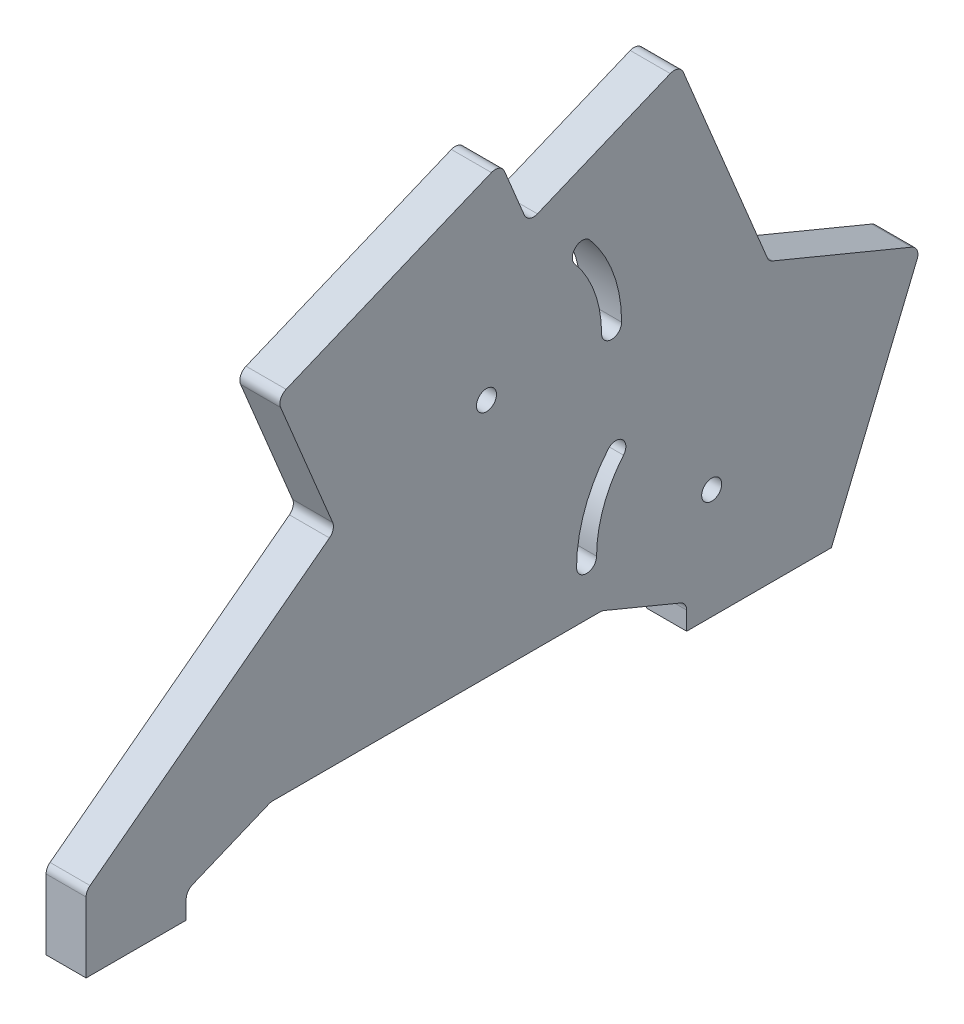
from build123d import *

# Parameters (mm, degrees)
SKETCH1_R                   = 2
BOSS_EXTRUDE1_DEPTH         = 8
FILLET1_R                   = 2
TAP_DRILL_FOR_M3_TAP1_D     = 2.5
TAP_DRILL_FOR_M3_TAP1_DEPTH = 10
TAP_DRILL_FOR_M3_TAP1_TIP   = 0.751075774


with BuildPart() as part:
    # Sketch1 → Boss-Extrude1 (new body)
    with BuildSketch(Plane(origin=(0, 0, 0), x_dir=(0, 0, -1), z_dir=(1, 0, 0))):
        Polygon((0, 0), (0, 15), (49.854455432, 52.772847367), (38.110170638, 81.126058999), (82.834388097, 99.651436437), (88.330517158, 86.382607119), (118.575687602, 98.910566914), (136.428533447, 55.809984346), (166.824723678, 43.219470108), (148.922633001, 0), (120, 0), (120, 5), (103.100505063, 12), (36.899494937, 12), (20, 5), (20, 0), align=None)
        with Locations((80, 60)):
            Circle(SKETCH1_R, mode=Mode.SUBTRACT)
        with Locations((125, 22)):
            Circle(SKETCH1_R, mode=Mode.SUBTRACT)
        with BuildLine():
            ThreePointArc((107, 60), (105.371700761, 69.23454387), (100.683199964, 77.355265462))
            ThreePointArc((100.683199964, 77.355265462), (97.865535859, 77.601779128), (97.619022192, 74.784115023))
            ThreePointArc((97.619022192, 74.784115023), (101.612930278, 67.866463296), (103, 60))
            ThreePointArc((103, 60), (105, 58), (107, 60))
        make_face(mode=Mode.SUBTRACT)
        with BuildLine():
            ThreePointArc((104.316800036, 39.355265462), (99.628299239, 31.23454387), (98, 22))
            ThreePointArc((98, 22), (100, 20), (102, 22))
            ThreePointArc((102, 22), (103.387069722, 29.866463296), (107.380977808, 36.784115023))
            ThreePointArc((107.380977808, 36.784115023), (107.134464141, 39.601779128), (104.316800036, 39.355265462))
        make_face(mode=Mode.SUBTRACT)
    extrude(amount=BOSS_EXTRUDE1_DEPTH)

    # Fillet1
    fillet1_edges = [part.edges().sort_by_distance(p)[0] for p in [
        (4, 12, -36.899494937),
        (4, 5, -20),
        (4, 12, -103.100505063),
        (4, 43.219470108, -166.824723678),
        (4, 55.809984346, -136.428533447),
        (4, 98.910566914, -118.575687602),
        (4, 86.382607119, -88.330517158),
        (4, 99.651436437, -82.834388097),
        (4, 81.126058999, -38.110170638),
        (4, 52.772847367, -49.854455432),
        (4, 15, 0),
        (4, 5, -120),
    ]]
    fillet(fillet1_edges, radius=FILLET1_R)

    # Tap Drill for M3 Tap1
    with Locations(Plane(origin=(0, 0, 0), x_dir=(-1, 0, 0), z_dir=(0, -1, 0))):
        with Locations((-4, 10), (-4, 130)):
            Hole(TAP_DRILL_FOR_M3_TAP1_D / 2, depth=TAP_DRILL_FOR_M3_TAP1_DEPTH)
            with Locations((0, 0, -(TAP_DRILL_FOR_M3_TAP1_DEPTH + TAP_DRILL_FOR_M3_TAP1_TIP / 2))):  # 118° drill point
                Cone(0, TAP_DRILL_FOR_M3_TAP1_D / 2, TAP_DRILL_FOR_M3_TAP1_TIP, mode=Mode.SUBTRACT)


solid = part.part
